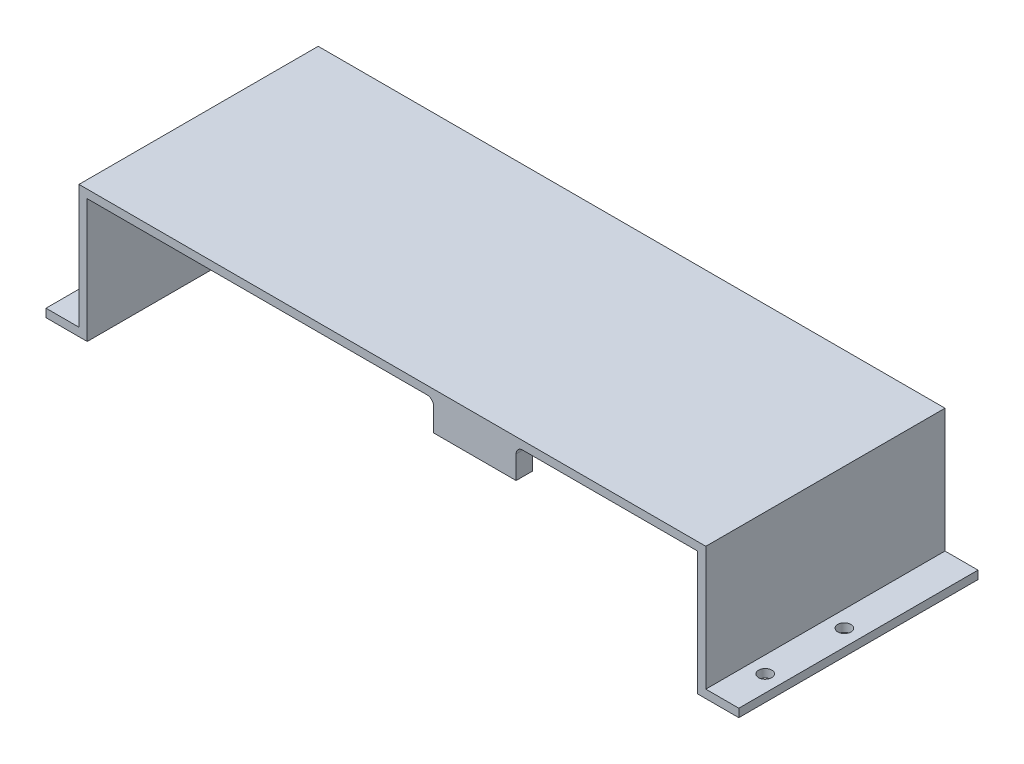
from build123d import *

# Parameters (mm, degrees)
SKETCH1_W           = 234.95
SKETCH1_H           = 92.075
BOSS_EXTRUDE1_DEPTH = 3.175
SKETCH3_W           = 3.175
SKETCH3_H           = 92.075
BOSS_EXTRUDE2_DEPTH = 50.8
SKETCH4_W           = 92.075
SKETCH4_H           = 3.175
BOSS_EXTRUDE3_DEPTH = 12.7
SKETCH5_R           = 2.54
CUT_EXTRUDE1_DEPTH  = 12.7
SKETCH6_W           = 31.75
SKETCH6_H           = 11.43
BOSS_EXTRUDE4_DEPTH = 6.35
FILLET1_R           = 2.54


with BuildPart() as part:
    # Sketch1 → Boss-Extrude1 (new body)
    with BuildSketch(Plane(origin=(0, 0, 0), x_dir=(1, 0, 0), z_dir=(0, 1, 0))):
        Rectangle(SKETCH1_W, SKETCH1_H)
    extrude(amount=BOSS_EXTRUDE1_DEPTH)

    # Sketch3 → Boss-Extrude2 (add)
    with BuildSketch(Plane(origin=(0, 3.175, 0), x_dir=(1, 0, 0), z_dir=(0, 1, 0))):
        with Locations((-119.0625, 0)):
            Rectangle(SKETCH3_W, SKETCH3_H)
        with Locations((119.0625, 0)):
            Rectangle(SKETCH3_W, SKETCH3_H)
    extrude(amount=-BOSS_EXTRUDE2_DEPTH)

    # Sketch4 → Boss-Extrude3 (add)
    with BuildSketch(Plane(origin=(120.65, 0, 0), x_dir=(0, 0, -1), z_dir=(1, 0, 0))):
        with Locations((0, -46.0375)):
            Rectangle(SKETCH4_W, SKETCH4_H)
    boss_extrude3 = extrude(amount=BOSS_EXTRUDE3_DEPTH)

    # Sketch5 → Cut-Extrude1 (cut)
    with BuildSketch(Plane.XZ.offset(47.625)):
        with Locations((127, -0.9525)):
            Circle(SKETCH5_R)
        with Locations((127, 29.5275)):
            Circle(SKETCH5_R)
    cut_extrude1 = extrude(amount=-CUT_EXTRUDE1_DEPTH, mode=Mode.SUBTRACT)

    # Mirror1: Boss-Extrude3, Cut-Extrude1 across plane
    add(boss_extrude3.mirror(Plane(origin=(0, 0, 0), x_dir=(0, 0, 1), z_dir=(1, 0, 0))))
    add(cut_extrude1.mirror(Plane(origin=(0, 0, 0), x_dir=(0, 0, 1), z_dir=(1, 0, 0))), mode=Mode.SUBTRACT)

    # Sketch6 → Boss-Extrude4 (add)
    with BuildSketch(Plane.XY.offset(46.0375)):
        with Locations((31.75, -5.715)):
            Rectangle(SKETCH6_W, SKETCH6_H)
    extrude(amount=-BOSS_EXTRUDE4_DEPTH)

    # Fillet1
    fillet1_edges = [part.edges().sort_by_distance(p)[0] for p in [
        (47.625, 0, 42.8625),
        (15.875, 0, 42.8625),
    ]]
    fillet(fillet1_edges, radius=FILLET1_R)


solid = part.part
